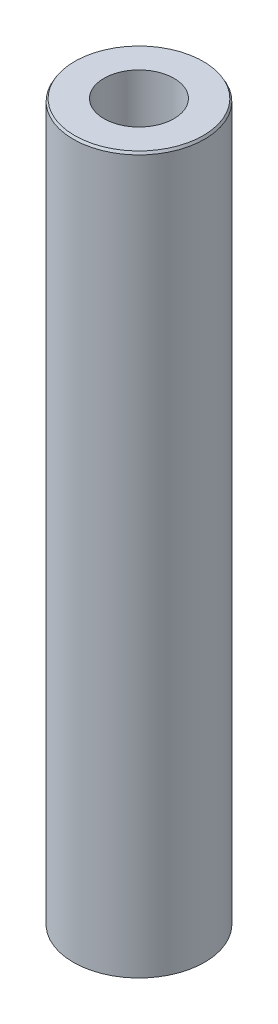
from build123d import *
from OCP.BRepFilletAPI import BRepFilletAPI_MakeChamfer

# Parameters (mm, degrees)
SKETCH1_R           = 55
BOSS_EXTRUDE1_DEPTH = 600
SKETCH2_R           = 29.311654478
CUT_EXTRUDE1_DEPTH  = 606.020660804
CHAMFER1_SIZE       = 2.043143109
CHAMFER1_SIZE2      = 1.179609224


with BuildPart() as part:
    # Sketch1 → Boss-Extrude1 (new body)
    with BuildSketch(Plane(origin=(0, 0, 0), x_dir=(1, 0, 0), z_dir=(0, 1, 0))):
        Circle(SKETCH1_R)
    extrude(amount=BOSS_EXTRUDE1_DEPTH)

    # Sketch2 → Cut-Extrude1 (cut, through all)
    with BuildSketch(Plane(origin=(0, 0, 0), x_dir=(1, 0, 0), z_dir=(0, 1, 0))):
        Circle(SKETCH2_R)
    extrude(amount=CUT_EXTRUDE1_DEPTH, mode=Mode.SUBTRACT)

    # Chamfer1: one chamfer whose edges measure the first distance from different faces: ONE call of the kernel's chamfer builder (chamfer() names one face for all edges)
    chamfer1_edges_1 = [part.edges().sort_by_distance(p)[0] for p in [
        (-55, 600, 0),
    ]]
    chamfer1_side_1 = [part.faces().sort_by_distance(p)[0] for p in [
        (-55, 300, 0),
    ]]
    chamfer1_edges_2 = [part.edges().sort_by_distance(p)[0] for p in [
        (-55, 0, 0),
    ]]
    chamfer1_side_2 = [part.faces().sort_by_distance(p)[0] for p in [
        (-53.444365081, 0, 0),
    ]]
    chamfer1 = BRepFilletAPI_MakeChamfer(part.part.solid().wrapped)
    for e in chamfer1_edges_1:
        chamfer1.Add(CHAMFER1_SIZE, CHAMFER1_SIZE2, e.wrapped, chamfer1_side_1[0].wrapped)  # the first distance lies on this face
    for e in chamfer1_edges_2:
        chamfer1.Add(CHAMFER1_SIZE, CHAMFER1_SIZE2, e.wrapped, chamfer1_side_2[0].wrapped)  # the first distance lies on this face
    add(Compound.cast(chamfer1.Shape()), mode=Mode.REPLACE)


solid = part.part
